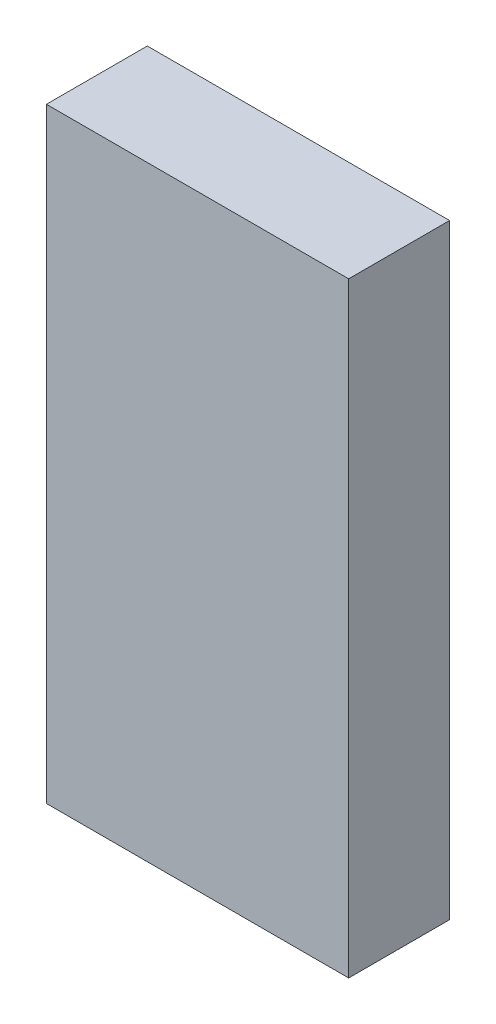
from build123d import *

# Parameters (mm, degrees)
SKETCH1_W           = 76.07554
SKETCH1_H           = 152.4
BOSS_EXTRUDE1_DEPTH = 25.4


with BuildPart() as part:
    # Sketch1 → Boss-Extrude1 (new body)
    with BuildSketch(Plane.XY):
        Rectangle(SKETCH1_W, SKETCH1_H)
    extrude(amount=BOSS_EXTRUDE1_DEPTH)


solid = part.part
